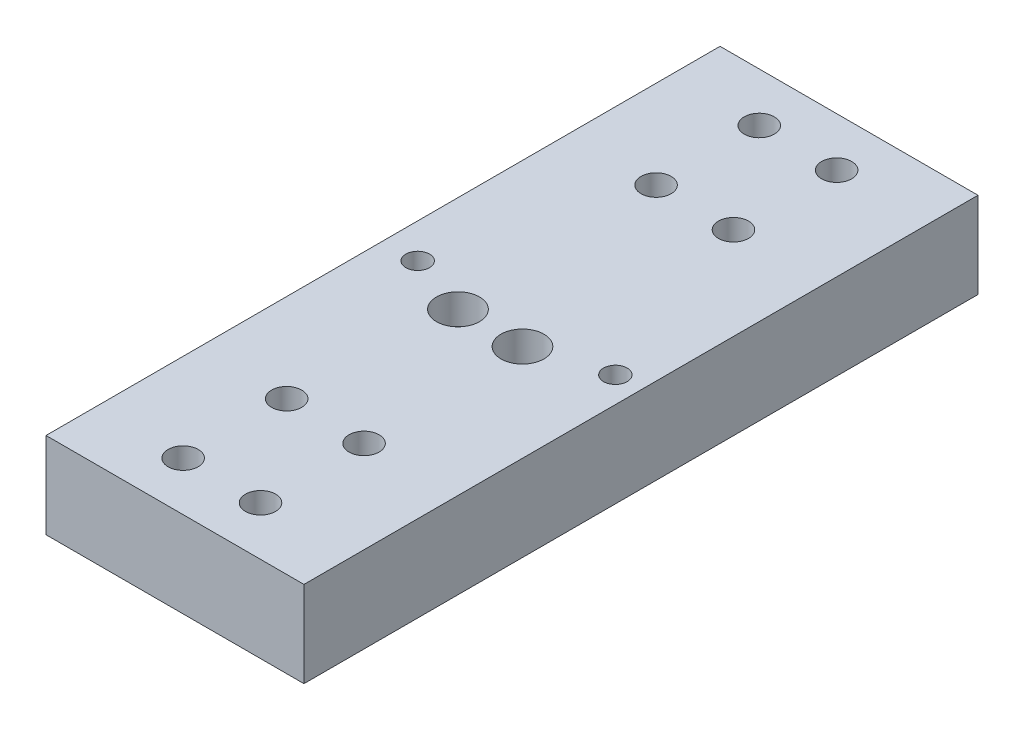
from build123d import *

# Parameters (mm, degrees)
SKETCH3_W           = 156.772980402
SKETCH3_H           = 60
BOSS_EXTRUDE6_DEPTH = 20
CUT_EXTRUDE1_REACH  = 113.348
SKETCH4_R           = 2.25
CUT_EXTRUDE2_REACH  = 113.348
SKETCH6_R           = 3.25
SKETCH7_R           = 3.5
CUT_EXTRUDE3_DEPTH  = 5
SKETCH8_R           = 5
CUT_EXTRUDE4_DEPTH  = 7
CUT_EXTRUDE5_REACH  = 113.348
SKETCH9_R           = 2.75


with BuildPart() as part:
    # Sketch3 → Boss-Extrude6 (new body)
    with BuildSketch(Plane(origin=(-27.52701042, 0, 0), x_dir=(0, 0, 1), z_dir=(0, 1, 0))):
        with Locations((-23.695908121, 17.809773729)):
            Rectangle(SKETCH3_W, SKETCH3_H)
    extrude(amount=BOSS_EXTRUDE6_DEPTH)

    # Sketch4 → Cut-Extrude1 (cut, up to next)
    with BuildSketch(Plane(origin=(0, 20, 0), x_dir=(1, 0, 0), z_dir=(0, 1, 0)), mode=Mode.PRIVATE) as cut_extrude1_sk1:
        with Locations((-1.126993796, -19.304091879)):
            Circle(SKETCH4_R)
    cut_extrude1_tool1 = extrude(cut_extrude1_sk1.sketch, amount=-CUT_EXTRUDE1_REACH, mode=Mode.PRIVATE) & part.part
    # Sketch4 → Cut-Extrude1 (cut, up to next)
    with BuildSketch(Plane(origin=(0, 20, 0), x_dir=(1, 0, 0), z_dir=(0, 1, 0)), mode=Mode.PRIVATE) as cut_extrude1_sk2:
        with Locations((-19.127096376, -19.304091879)):
            Circle(SKETCH4_R)
    cut_extrude1_tool2 = extrude(cut_extrude1_sk2.sketch, amount=-CUT_EXTRUDE1_REACH, mode=Mode.PRIVATE) & part.part
    # Sketch4 → Cut-Extrude1 (cut, up to next)
    with BuildSketch(Plane(origin=(0, 20, 0), x_dir=(1, 0, 0), z_dir=(0, 1, 0)), mode=Mode.PRIVATE) as cut_extrude1_sk3:
        with Locations((-1.2080193, -43.304091879)):
            Circle(SKETCH4_R)
    cut_extrude1_tool3 = extrude(cut_extrude1_sk3.sketch, amount=-CUT_EXTRUDE1_REACH, mode=Mode.PRIVATE) & part.part
    # Sketch4 → Cut-Extrude1 (cut, up to next)
    with BuildSketch(Plane(origin=(0, 20, 0), x_dir=(1, 0, 0), z_dir=(0, 1, 0)), mode=Mode.PRIVATE) as cut_extrude1_sk4:
        with Locations((-19.208121879, -43.304091879)):
            Circle(SKETCH4_R)
    cut_extrude1_tool4 = extrude(cut_extrude1_sk4.sketch, amount=-CUT_EXTRUDE1_REACH, mode=Mode.PRIVATE) & part.part
    # Sketch4 → Cut-Extrude1 (cut, up to next)
    with BuildSketch(Plane(origin=(0, 20, 0), x_dir=(1, 0, 0), z_dir=(0, 1, 0)), mode=Mode.PRIVATE) as cut_extrude1_sk5:
        with Locations((-19.208121879, 66.695908121)):
            Circle(SKETCH4_R)
    cut_extrude1_tool5 = extrude(cut_extrude1_sk5.sketch, amount=-CUT_EXTRUDE1_REACH, mode=Mode.PRIVATE) & part.part
    # Sketch4 → Cut-Extrude1 (cut, up to next)
    with BuildSketch(Plane(origin=(0, 20, 0), x_dir=(1, 0, 0), z_dir=(0, 1, 0)), mode=Mode.PRIVATE) as cut_extrude1_sk6:
        with Locations((-19.208121879, 90.695908121)):
            Circle(SKETCH4_R)
    cut_extrude1_tool6 = extrude(cut_extrude1_sk6.sketch, amount=-CUT_EXTRUDE1_REACH, mode=Mode.PRIVATE) & part.part
    # Sketch4 → Cut-Extrude1 (cut, up to next)
    with BuildSketch(Plane(origin=(0, 20, 0), x_dir=(1, 0, 0), z_dir=(0, 1, 0)), mode=Mode.PRIVATE) as cut_extrude1_sk7:
        with Locations((-1.2080193, 90.695908121)):
            Circle(SKETCH4_R)
    cut_extrude1_tool7 = extrude(cut_extrude1_sk7.sketch, amount=-CUT_EXTRUDE1_REACH, mode=Mode.PRIVATE) & part.part
    # Sketch4 → Cut-Extrude1 (cut, up to next)
    with BuildSketch(Plane(origin=(0, 20, 0), x_dir=(1, 0, 0), z_dir=(0, 1, 0)), mode=Mode.PRIVATE) as cut_extrude1_sk8:
        with Locations((-1.2080193, 66.695908121)):
            Circle(SKETCH4_R)
    cut_extrude1_tool8 = extrude(cut_extrude1_sk8.sketch, amount=-CUT_EXTRUDE1_REACH, mode=Mode.PRIVATE) & part.part
    add(cut_extrude1_tool1.solids().sort_by_distance((-1.126994, 20, 19.304092))[0], mode=Mode.SUBTRACT)
    add(cut_extrude1_tool2.solids().sort_by_distance((-19.127096, 20, 19.304092))[0], mode=Mode.SUBTRACT)
    add(cut_extrude1_tool3.solids().sort_by_distance((-1.208019, 20, 43.304092))[0], mode=Mode.SUBTRACT)
    add(cut_extrude1_tool4.solids().sort_by_distance((-19.208122, 20, 43.304092))[0], mode=Mode.SUBTRACT)
    add(cut_extrude1_tool5.solids().sort_by_distance((-19.208122, 20, -66.695908))[0], mode=Mode.SUBTRACT)
    add(cut_extrude1_tool6.solids().sort_by_distance((-19.208122, 20, -90.695908))[0], mode=Mode.SUBTRACT)
    add(cut_extrude1_tool7.solids().sort_by_distance((-1.208019, 20, -90.695908))[0], mode=Mode.SUBTRACT)
    add(cut_extrude1_tool8.solids().sort_by_distance((-1.208019, 20, -66.695908))[0], mode=Mode.SUBTRACT)

    # Sketch6 → Cut-Extrude2 (cut, up to next)
    with BuildSketch(Plane(origin=(0, 20, 0), x_dir=(1, 0, 0), z_dir=(0, 1, 0)), mode=Mode.PRIVATE) as cut_extrude2_sk1:
        with Locations((-17.217236691, 18.631632081)):
            Circle(SKETCH6_R)
    cut_extrude2_tool1 = extrude(cut_extrude2_sk1.sketch, amount=-CUT_EXTRUDE2_REACH, mode=Mode.PRIVATE) & part.part
    # Sketch6 → Cut-Extrude2 (cut, up to next)
    with BuildSketch(Plane(origin=(0, 20, 0), x_dir=(1, 0, 0), z_dir=(0, 1, 0)), mode=Mode.PRIVATE) as cut_extrude2_sk2:
        with Locations((-2.217236691, 18.631632081)):
            Circle(SKETCH6_R)
    cut_extrude2_tool2 = extrude(cut_extrude2_sk2.sketch, amount=-CUT_EXTRUDE2_REACH, mode=Mode.PRIVATE) & part.part
    add(cut_extrude2_tool1.solids().sort_by_distance((-17.217237, 20, -18.631632))[0], mode=Mode.SUBTRACT)
    add(cut_extrude2_tool2.solids().sort_by_distance((-2.217237, 20, -18.631632))[0], mode=Mode.SUBTRACT)

    # Sketch7 → Cut-Extrude3 (cut)
    with BuildSketch(Plane(origin=(0, 20, 0), x_dir=(1, 0, 0), z_dir=(0, 1, 0))):
        with Locations((-19.127096376, -19.304091879)):
            Circle(SKETCH7_R)
        with Locations((-19.208121879, -43.304091879)):
            Circle(SKETCH7_R)
        with Locations((-1.2080193, -43.304091879)):
            Circle(SKETCH7_R)
        with Locations((-1.126993796, -19.304091879)):
            Circle(SKETCH7_R)
        with Locations((-1.2080193, 66.695908121)):
            Circle(SKETCH7_R)
        with Locations((-19.208121879, 66.695908121)):
            Circle(SKETCH7_R)
        with Locations((-19.208121879, 90.695908121)):
            Circle(SKETCH7_R)
        with Locations((-1.2080193, 90.695908121)):
            Circle(SKETCH7_R)
    extrude(amount=-CUT_EXTRUDE3_DEPTH, mode=Mode.SUBTRACT)

    # Sketch8 → Cut-Extrude4 (cut)
    with BuildSketch(Plane(origin=(0, 20, 0), x_dir=(1, 0, 0), z_dir=(0, 1, 0))):
        with Locations((-17.217236691, 18.631632081)):
            Circle(SKETCH8_R)
        with Locations((-2.217236691, 18.631632081)):
            Circle(SKETCH8_R)
    extrude(amount=-CUT_EXTRUDE4_DEPTH, mode=Mode.SUBTRACT)

    # Sketch9 → Cut-Extrude5 (cut, up to next)
    with BuildSketch(Plane(origin=(0, 20, 0), x_dir=(1, 0, 0), z_dir=(0, 1, 0)), mode=Mode.PRIVATE) as cut_extrude5_sk1:
        with Locations((-31.657880115, 23.701844607)):
            Circle(SKETCH9_R)
    cut_extrude5_tool1 = extrude(cut_extrude5_sk1.sketch, amount=-CUT_EXTRUDE5_REACH, mode=Mode.PRIVATE) & part.part
    # Sketch9 → Cut-Extrude5 (cut, up to next)
    with BuildSketch(Plane(origin=(0, 20, 0), x_dir=(1, 0, 0), z_dir=(0, 1, 0)), mode=Mode.PRIVATE) as cut_extrude5_sk2:
        with Locations((14.282732382, 23.735684254)):
            Circle(SKETCH9_R)
    cut_extrude5_tool2 = extrude(cut_extrude5_sk2.sketch, amount=-CUT_EXTRUDE5_REACH, mode=Mode.PRIVATE) & part.part
    add(cut_extrude5_tool1.solids().sort_by_distance((-31.65788, 20, -23.701845))[0], mode=Mode.SUBTRACT)
    add(cut_extrude5_tool2.solids().sort_by_distance((14.282732, 20, -23.735684))[0], mode=Mode.SUBTRACT)


solid = part.part
